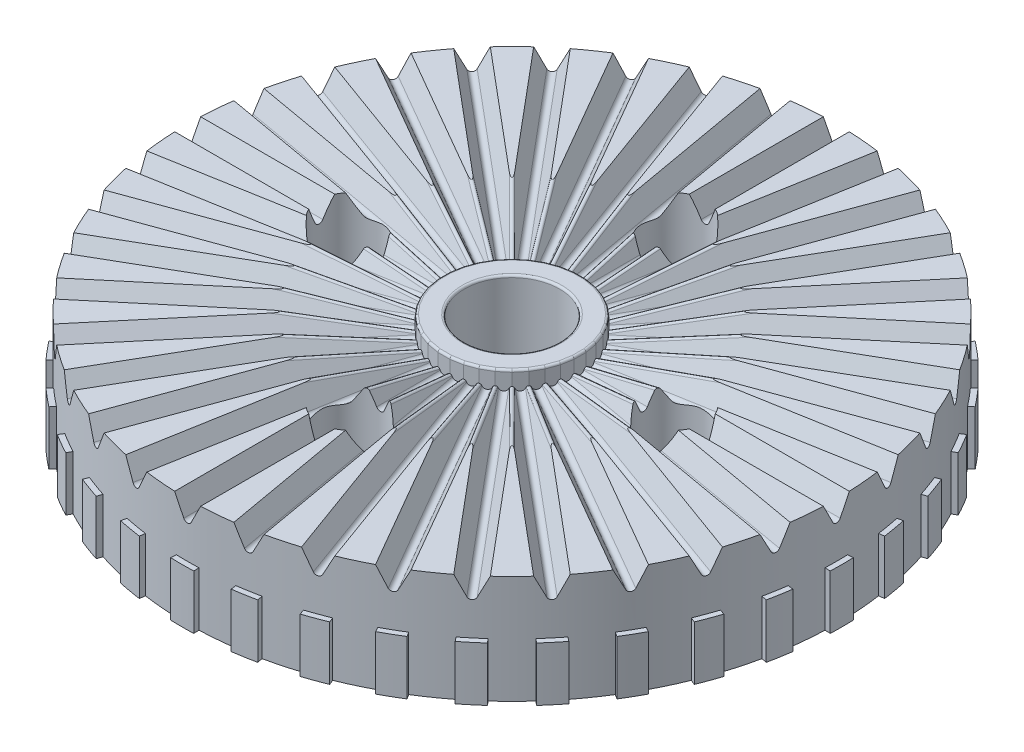
from build123d import *

# Parameters (mm, degrees)
SKETCH1_R                               = 30
BODY_DEPTH                              = 10
SKETCH4_R                               = 4.4
CENTER_HOLE_DEPTH                       = 44.588989435
SLOT_DEPTH                              = 23.7
SLOT_PATTERN_COUNT                      = 36
ANGLE_INDICATOR_DEPTH                   = 5
ANGLE_INDICATOR_PATTERN_COUNT           = 36
SKETCH6_R                               = 1.6
MOUNTING_HOLE_PATTERN_DEPTH             = 45.277533829
SKETCH7_R                               = 2.85
MOUNTING_HOLE_PATTERN_COUNTERBORE_DEPTH = 6
CENTER_SHAFT_CLEARANCE_CUT_DEPTH        = 0.2
SHAFT_APPROACH_FILLET_R                 = 0.2
SHAFT_FILLET_R                          = 0.2


# Read off the part's stored shape, not the designer's step: Angle Indicator
with BuildPart() as part:
    # Sketch1 → Body (new body)
    with BuildSketch(Plane(origin=(0, 0, 0), x_dir=(1, 0, 0), z_dir=(0, 1, 0))):
        with Locations(Location((0, 0, 0), (0, 0, 270))):
            Circle(SKETCH1_R)
    extrude(amount=BODY_DEPTH)

    # Sketch4 → Center Hole (cut, through all)
    with BuildSketch(Plane(origin=(0, 0, 0), x_dir=(1, 0, 0), z_dir=(0, 1, 0))):
        with Locations(Location((0, 0, 0), (0, 0, 270))):
            Circle(SKETCH4_R)
    extrude(amount=CENTER_HOLE_DEPTH, mode=Mode.SUBTRACT)

    # Sketch3 → Slot (cut)
    with BuildSketch(Plane(origin=(30, 0, 0), x_dir=(0, 0, -1), z_dir=(1, 0, 0))):
        with BuildLine():
            Line((-1.2, 10), (-0.339882333, 8.279764665))
            ThreePointArc((-0.339882333, 8.279764665), (0, 8.069705831), (0.339882333, 8.279764665))
            Line((0.339882333, 8.279764665), (1.2, 10))
            Line((1.2, 10), (-1.2, 10))
        make_face()
    slot = extrude(amount=-SLOT_DEPTH, mode=Mode.SUBTRACT)

    # Slot Pattern: Slot ×36 about axis
    slot_pattern_axis = Axis((0, 0, 0), (0, 1, 0))
    for i in range(1, SLOT_PATTERN_COUNT):
        add(slot.rotate(slot_pattern_axis, i * 360 / SLOT_PATTERN_COUNT), mode=Mode.SUBTRACT)

    # Angle Indicator outline → Angle Indicator (add)
    with BuildSketch(Plane(origin=(0, 0, 0), x_dir=(1, 0, 0), z_dir=(0, 1, 0))):
        with BuildLine():
            ThreePointArc((-1.064434649, -30.481420224), (0, -30.5), (1.064434649, -30.481420224))
            Line((1.064434649, -30.481420224), (1.046984901, -29.981724811))
            ThreePointArc((1.046984901, -29.981724811), (0, -30), (-1.046984901, -29.981724811))
            Line((-1.046984901, -29.981724811), (-1.064434649, -30.481420224))
        make_face()
    angle_indicator = extrude(amount=ANGLE_INDICATOR_DEPTH)

    # Angle Indicator Pattern: Angle Indicator ×36 about axis
    angle_indicator_pattern_axis = Axis((0, 0, 0), (0, 1, 0))
    for i in range(1, ANGLE_INDICATOR_PATTERN_COUNT):
        add(angle_indicator.rotate(angle_indicator_pattern_axis, i * 360 / ANGLE_INDICATOR_PATTERN_COUNT))

    # Sketch6 → Mounting Hole Pattern (cut, through all)
    with BuildSketch(Plane(origin=(0, 10, 0), x_dir=(1, 0, 0), z_dir=(0, 1, 0))):
        with Locations(Location((0, -15, 0), (0, 0, 270))):
            Circle(SKETCH6_R)
        with Locations(Location((-15, 0, 0), (0, 0, 270))):
            Circle(SKETCH6_R)
        with Locations(Location((0, 15, 0), (0, 0, 270))):
            Circle(SKETCH6_R)
        with Locations(Location((15, 0, 0), (0, 0, 270))):
            Circle(SKETCH6_R)
    extrude(amount=-MOUNTING_HOLE_PATTERN_DEPTH, mode=Mode.SUBTRACT)

    # Sketch7 → Mounting Hole Pattern Counterbore (cut)
    with BuildSketch(Plane(origin=(0, 10, 0), x_dir=(1, 0, 0), z_dir=(0, 1, 0))):
        with Locations(Location((0, 15, 0), (0, 0, 270))):
            Circle(SKETCH7_R)
        with Locations(Location((15, 0, 0), (0, 0, 270))):
            Circle(SKETCH7_R)
        with Locations(Location((0, -15, 0), (0, 0, 270))):
            Circle(SKETCH7_R)
        with Locations(Location((-15, 0, 0), (0, 0, 270))):
            Circle(SKETCH7_R)
    extrude(amount=-MOUNTING_HOLE_PATTERN_COUNTERBORE_DEPTH, mode=Mode.SUBTRACT)

    # Sketch8 → Center Shaft Clearance Cut (cut)
    with BuildSketch(Plane(origin=(0, 10, 0), x_dir=(1, 0, 0), z_dir=(0, 1, 0))):
        Polygon((6.3, 0.55117858), (6.108577688, 1.636788458), (5.731549334, 2.672665348), (5.180370754, 3.627334652), (4.47178923, 4.47178923), (3.627334652, 5.180370754), (2.672665348, 5.731549334), (1.636788458, 6.108577688), (0.55117858, 6.3), (-0.55117858, 6.3), (-1.636788458, 6.108577688), (-2.672665348, 5.731549334), (-3.627334652, 5.180370754), (-4.47178923, 4.47178923), (-5.180370754, 3.627334652), (-5.731549334, 2.672665348), (-6.108577688, 1.636788458), (-6.3, 0.55117858), (-6.3, -0.55117858), (-6.108577688, -1.636788458), (-5.731549334, -2.672665348), (-5.180370754, -3.627334652), (-4.47178923, -4.47178923), (-3.627334652, -5.180370754), (-2.672665348, -5.731549334), (-1.636788458, -6.108577688), (-0.55117858, -6.3), (0.55117858, -6.3), (1.636788458, -6.108577688), (2.672665348, -5.731549334), (3.627334652, -5.180370754), (4.47178923, -4.47178923), (5.180370754, -3.627334652), (5.731549334, -2.672665348), (6.108577688, -1.636788458), (6.3, -0.55117858), align=None)
    extrude(amount=-CENTER_SHAFT_CLEARANCE_CUT_DEPTH, mode=Mode.SUBTRACT)

    # Shaft Approach Fillet
    shaft_approach_fillet_edges = [part.edges().sort_by_distance(p)[0] for p in [
        (-9.703942412, 9.35117858, 2.600163533),
        (-9.105004063, 9.35117858, 4.245733122),
        (-8.229414773, 9.35117858, 5.762298259),
        (-7.10377888, 9.35117858, 7.10377888),
        (-5.762298259, 9.35117858, 8.229414773),
        (-4.245733122, 9.35117858, 9.105004063),
        (-2.600163533, 9.35117858, 9.703942412),
        (-0.816410581, 9.232821161, 9.331615636),
        (0.816410581, 9.232821161, 9.331615636),
        (2.600163533, 9.35117858, 9.703942412),
        (4.245733122, 9.35117858, 9.105004063),
        (5.762298259, 9.35117858, 8.229414773),
        (7.10377888, 9.35117858, 7.10377888),
        (8.229414773, 9.35117858, 5.762298259),
        (9.105004063, 9.35117858, 4.245733122),
        (9.703942412, 9.35117858, 2.600163533),
        (9.331615636, 9.232821161, 0.816410581),
        (9.331615636, 9.232821161, -0.816410581),
        (9.703942412, 9.35117858, -2.600163533),
        (9.105004063, 9.35117858, -4.245733122),
        (8.229414773, 9.35117858, -5.762298259),
        (7.10377888, 9.35117858, -7.10377888),
        (5.762298259, 9.35117858, -8.229414773),
        (4.245733122, 9.35117858, -9.105004063),
        (2.600163533, 9.35117858, -9.703942412),
        (0.816410581, 9.232821161, -9.331615636),
        (-0.816410581, 9.232821161, -9.331615636),
        (-2.600163533, 9.35117858, -9.703942412),
        (-4.245733122, 9.35117858, -9.105004063),
        (-5.762298259, 9.35117858, -8.229414773),
        (-7.10377888, 9.35117858, -7.10377888),
        (-8.229414773, 9.35117858, -5.762298259),
        (-9.105004063, 9.35117858, -4.245733122),
        (-9.703942412, 9.35117858, -2.600163533),
        (-9.331615636, 9.232821161, -0.816410581),
        (-9.331615636, 9.232821161, 0.816410581),
    ]]
    fillet(shaft_approach_fillet_edges, radius=SHAFT_APPROACH_FILLET_R)

    # Shaft Fillet
    shaft_fillet_edges = [part.edges().sort_by_distance(p)[0] for p in [
        (6.3, 9.8, 0),
        (6.204288844, 9.8, 1.093983519),
        (5.920063511, 9.8, 2.154726903),
        (5.455960044, 9.8, 3.15),
        (4.826079992, 9.8, 4.049561941),
        (4.049561941, 9.8, 4.826079992),
        (3.15, 9.8, 5.455960044),
        (2.154726903, 9.8, 5.920063511),
        (1.093983519, 9.8, 6.204288844),
        (0, 9.8, 6.3),
        (-1.093983519, 9.8, 6.204288844),
        (-2.154726903, 9.8, 5.920063511),
        (-3.15, 9.8, 5.455960044),
        (-4.049561941, 9.8, 4.826079992),
        (-4.826079992, 9.8, 4.049561941),
        (-5.455960044, 9.8, 3.15),
        (-5.920063511, 9.8, 2.154726903),
        (-6.204288844, 9.8, 1.093983519),
        (-6.3, 9.8, 0),
        (-6.204288844, 9.8, -1.093983519),
        (-5.920063511, 9.8, -2.154726903),
        (-5.455960044, 9.8, -3.15),
        (-4.826079992, 9.8, -4.049561941),
        (-4.049561941, 9.8, -4.826079992),
        (-3.15, 9.8, -5.455960044),
        (-2.154726903, 9.8, -5.920063511),
        (-1.093983519, 9.8, -6.204288844),
        (0, 9.8, -6.3),
        (1.093983519, 9.8, -6.204288844),
        (2.154726903, 9.8, -5.920063511),
        (3.15, 9.8, -5.455960044),
        (4.049561941, 9.8, -4.826079992),
        (4.826079992, 9.8, -4.049561941),
        (5.455960044, 9.8, -3.15),
        (5.920063511, 9.8, -2.154726903),
        (6.204288844, 9.8, -1.093983519),
        (0, 9.8, -4.4),
    ]]
    fillet(shaft_fillet_edges, radius=SHAFT_FILLET_R)


solid = part.part
